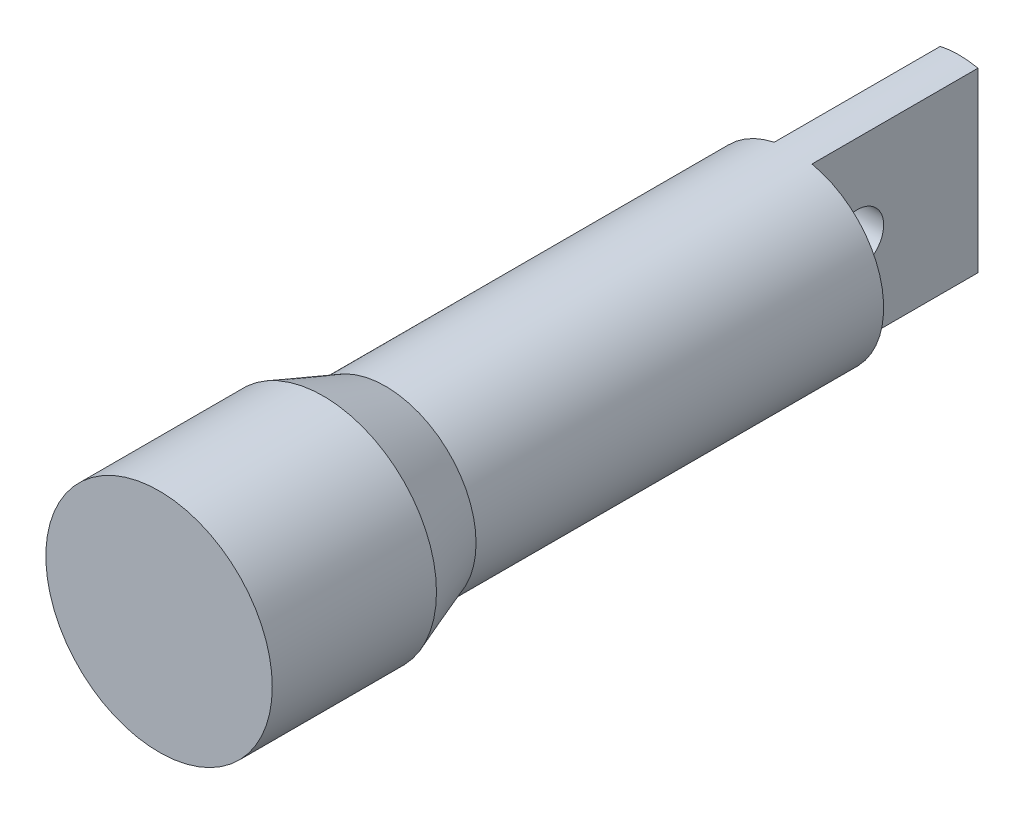
from build123d import *

# Parameters (mm, degrees)
SKETCH1_R           = 6
BOSS_EXTRUDE1_DEPTH = 27
BOSS_EXTRUDE2_START = 11
BOSS_EXTRUDE2_DEPTH = 11
SKETCH3_R           = 1.75
CUT_EXTRUDE1_DEPTH  = 6
SKETCH4_R           = 7.5
BOSS_EXTRUDE3_DEPTH = 15
CHAMFER1_SIZE2      = 1.5
CHAMFER1_SIZE       = 4.121216129


with BuildPart() as part:
    # Sketch1 → Boss-Extrude1 (new body)
    with BuildSketch(Plane.XY):
        Circle(SKETCH1_R)
    extrude(amount=BOSS_EXTRUDE1_DEPTH)

    # Sketch2 → Boss-Extrude2 (add)
    with BuildSketch(Plane(origin=(0, 0, 0), x_dir=(-1, 0, 0), z_dir=(0, 0, -1)).offset(BOSS_EXTRUDE2_START)):
        with BuildLine():
            Line((-1.25, -5.868347297), (-1.25, 5.868347297))
            ThreePointArc((-1.25, 5.868347297), (0, 6), (1.25, 5.868347297))
            Line((1.25, 5.868347297), (1.25, -5.868347297))
            ThreePointArc((1.25, -5.868347297), (0, -6), (-1.25, -5.868347297))
        make_face()
    extrude(amount=-BOSS_EXTRUDE2_DEPTH)

    # Sketch3 → Cut-Extrude1 (cut)
    with BuildSketch(Plane(origin=(1.25, 0, 0), x_dir=(0, 0, -1), z_dir=(1, 0, 0))):
        with Locations((3, 0)):
            Circle(SKETCH3_R)
    extrude(amount=-CUT_EXTRUDE1_DEPTH, mode=Mode.SUBTRACT)

    # Sketch4 → Boss-Extrude3 (add)
    with BuildSketch(Plane.XY.offset(27)):
        Circle(SKETCH4_R)
    extrude(amount=BOSS_EXTRUDE3_DEPTH)

    # Chamfer1
    chamfer1_edges = [part.edges().sort_by_distance(p)[0] for p in [
        (-7.5, 0, 27),
    ]]
    chamfer1_side = [part.faces().sort_by_distance(p)[0] for p in [
        (-7.5, 0, 27.03),
    ]]
    chamfer(chamfer1_edges, length=CHAMFER1_SIZE - 0.0001, length2=CHAMFER1_SIZE2 - 0.0001, reference=chamfer1_side[0])  # a hair under: the kernel refuses the full size


solid = part.part
